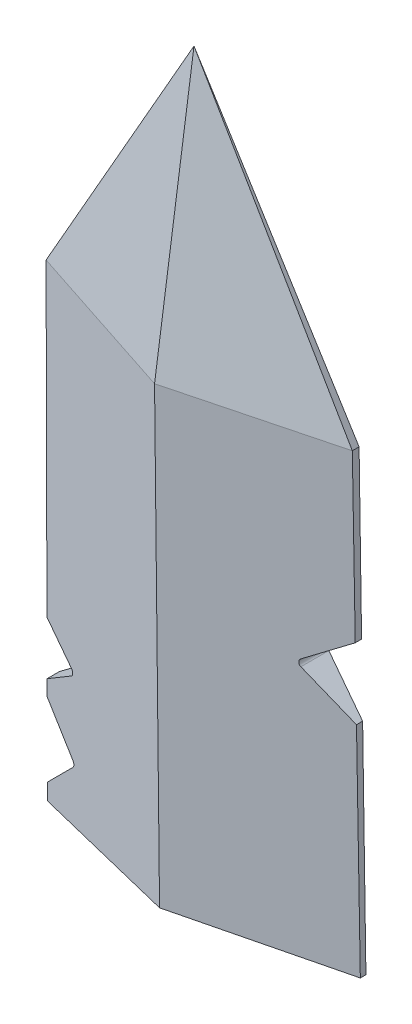
from build123d import *

# Parameters (mm, degrees)
BOSS_EXTRUDE1_DEPTH      = 9.525
BOSS_EXTRUDE1_DEPTH_BACK = 9.525
CUT_SWEEP2_START         = 153.457157687
CUT_SWEEP2_OUTLINE_W     = 59
CUT_SWEEP2_OUTLINE_H     = 64
CUT_SWEEP2_DEPTH         = 10.542842313
CUT_SWEEP6_START         = 153.457157687
CUT_SWEEP6_OUTLINE_W     = 53
CUT_SWEEP6_OUTLINE_H     = 64
CUT_SWEEP6_DEPTH         = 9.143384714
SKETCH21_W               = 71.62814367
SKETCH21_H               = 75.485551221
CUT_EXTRUDE5_DEPTH       = 47.371
CUT_EXTRUDE6_DEPTH       = 875.211365037
CUT_EXTRUDE6_DEPTH_BACK  = 875.211365037
SKETCH23_R               = 3.175
CUT_EXTRUDE7_DEPTH       = 558.8
CUT_EXTRUDE17_DEPTH      = 875.211365037
CUT_EXTRUDE17_DEPTH_BACK = 875.211365037
SKETCH24_W               = 149.671164142
SKETCH24_H               = 168.486967634
SKETCH24_H_2             = 161.925
SKETCH31_R               = 1.5875
CUT_EXTRUDE18_DEPTH      = 12.7


with BuildPart() as part:
    # Sketch1 → Boss-Extrude1 (new, two sides: drawn at the far end of the back side and taken through both)
    with BuildSketch(Plane.XY.offset(-BOSS_EXTRUDE1_DEPTH_BACK)):
        Polygon((57.217766507, 219.836565958), (134.681996719, 219.836565958), (125.140068317, 803.55209701), (88.830980485, 863.721914098), (57.217766507, 807.103985498), align=None)
    extrude(amount=BOSS_EXTRUDE1_DEPTH + BOSS_EXTRUDE1_DEPTH_BACK)

    # Cut-Sweep1: sweep along a path in Sketch4
    with BuildLine(Plane.XY.offset(9.525)) as cut_sweep1_path:
        Line((95.949881613, 219.836565958), (88.830980485, 863.721914098))
    # Sketch2 → Cut-Sweep1 (sweep, cut)
    with BuildSketch(Plane.XZ.offset(-219.836565958)):
        Polygon((95.949881613, 9.525), (134.681996719, 0), (134.681996719, 9.525), align=None)
    sweep(path=cut_sweep1_path.line, mode=Mode.SUBTRACT)

    # Cut-Sweep2: read off the stored shape, not the designer's step
    # Cut-Sweep2 outline → Cut-Sweep2 (cut)
    with BuildSketch(Plane(origin=(0, 0, 0), x_dir=(0.9721406430200956, -0.0370263288920756, -0.23145544097568965), z_dir=(0.2343983152423991, 0.15356253367517805, 0.9599354030677193)).offset(CUT_SWEEP2_START)):
        with Locations((63.5, 822)):
            Rectangle(CUT_SWEEP2_OUTLINE_W, CUT_SWEEP2_OUTLINE_H)
    extrude(amount=CUT_SWEEP2_DEPTH, mode=Mode.SUBTRACT)

    # Cut-Sweep3: sweep along a path in Sketch8
    with BuildLine(Plane.XY.offset(9.525)) as cut_sweep3_path:
        Line((95.949881613, 219.836565958), (88.830980485, 863.721914098))
    # Sketch7 → Cut-Sweep3 (sweep, cut)
    with BuildSketch(Plane.XZ.offset(-219.836565958)):
        Polygon((95.949881613, 9.525), (57.217766507, 0), (57.217766507, 9.525), align=None)
    sweep(path=cut_sweep3_path.line, mode=Mode.SUBTRACT)

    # Cut-Sweep4: sweep along a path in Sketch10
    with BuildLine(Plane(origin=(3.4015871, 0.0376085, -13.832090615), x_dir=(0.9710677735095292, -0.0006492893666849942, 0.23880317768941897), z_dir=(-0.23880406037428656, -0.002640256529482778, 0.9710641841784778))) as cut_sweep4_path:
        Line((55.419591582, 807.105343631), (88.664251397, 803.18099011))
    # Sketch9 → Cut-Sweep4 (sweep, cut)
    with BuildSketch(Plane(origin=(98.36840601, 1.087577095, 0), x_dir=(0, 0, 1), z_dir=(-0.9999388862366849, -0.011055486951654862, 0))):
        Polygon((9.525, 802.119504525), (27.927952665, 862.687059056), (0, 862.687059056), align=None)
    sweep(path=cut_sweep4_path.line, mode=Mode.SUBTRACT)

    # Cut-Sweep5: sweep along a path in Sketch12
    with BuildLine(Plane(origin=(0, 0, -9.525), x_dir=(-1, 0, 0), z_dir=(0, 0, -1))) as cut_sweep5_path:
        Line((-88.830980485, 863.721914098), (-95.949881613, 219.836565958))
    # Sketch11 → Cut-Sweep5 (sweep, cut)
    with BuildSketch(Plane.XZ.offset(-219.836565958)):
        Polygon((95.949881613, -9.525), (134.681996719, 0), (134.681996719, -15.883536915), (57.217766507, -15.883536915), (57.217766507, 0), align=None)
    sweep(path=cut_sweep5_path.line, mode=Mode.SUBTRACT)

    # Cut-Sweep6: read off the stored shape, not the designer's step
    # Cut-Sweep6 outline → Cut-Sweep6 (cut)
    with BuildSketch(Plane(origin=(0, 0, 0), x_dir=(0.9721406430200958, -0.03702632889207545, 0.2314554409756887), z_dir=(0.23439831524239813, 0.1535625336751781, -0.9599354030677195)).offset(CUT_SWEEP6_START)):
        with Locations((66.5, -822)):
            Rectangle(CUT_SWEEP6_OUTLINE_W, CUT_SWEEP6_OUTLINE_H)
    extrude(amount=CUT_SWEEP6_DEPTH, mode=Mode.SUBTRACT)

    # Sketch21 → Cut-Extrude5 (cut)
    with BuildSketch(Plane(origin=(-23.933102236, 16.341018935, -105.585382191), x_dir=(-0.9758175121644082, -0.033431767496308724, 0.2160150454837301), z_dir=(-0.2185867858615091, 0.14924646088248067, -0.9643367207364807))):
        with Locations((-95.99768501, 822.261491576)):
            Rectangle(SKETCH21_W, SKETCH21_H)
    extrude(amount=CUT_EXTRUDE5_DEPTH, mode=Mode.SUBTRACT)

    # Sketch22 → Cut-Extrude6 (cut, two sides: drawn at the far end of the back side and taken through both)
    with BuildSketch(Plane.XY.offset(-CUT_EXTRUDE6_DEPTH_BACK)):
        with BuildLine():
            Line((57.217766507, 737.561994928), (64.475710809, 732.15618288))
            ThreePointArc((64.475710809, 732.15618288), (64.859122479, 731.376710767), (64.450428737, 730.610192203))
            Line((64.450428737, 730.610192203), (57.217766507, 725.582342683))
            Line((57.217766507, 725.582342683), (57.217766507, 737.561994928))
        make_face()
        with BuildLine():
            Line((57.217766507, 722.071065301), (64.863611969, 714.425219839))
            ThreePointArc((64.863611969, 714.425219839), (65.14259276, 713.751700629), (64.863611969, 713.07818142))
            Line((64.863611969, 713.07818142), (57.217766507, 705.432335958))
            Line((57.217766507, 705.432335958), (57.217766507, 722.071065301))
        make_face()
        with BuildLine():
            Line((125.746024678, 766.483474766), (115.991696873, 759.702666979))
            ThreePointArc((115.991696873, 759.702666979), (115.583003131, 758.936148415), (115.966414801, 758.156676302))
            Line((115.966414801, 758.156676302), (126.004357543, 750.680284978))
            Line((126.004357543, 750.680284978), (125.746024678, 766.483474766))
        make_face()
        with BuildLine():
            Line((130.504368952, 475.397717553), (120.864153688, 462.45458434))
            ThreePointArc((120.864153688, 462.45458434), (120.675678689, 461.901197798), (120.845958337, 461.341944429))
            Line((120.845958337, 461.341944429), (130.972260191, 446.775056406))
            Line((130.972260191, 446.775056406), (130.504368952, 475.397717553))
        make_face()
        with BuildLine():
            Line((57.217766507, 423.998589411), (65.145848829, 412.59388421))
            ThreePointArc((65.145848829, 412.59388421), (65.316128476, 412.03463084), (65.127653478, 411.481244299))
            Line((65.127653478, 411.481244299), (57.217766507, 400.861282196))
            Line((57.217766507, 400.861282196), (57.217766507, 423.998589411))
        make_face()
    extrude(amount=CUT_EXTRUDE6_DEPTH + CUT_EXTRUDE6_DEPTH_BACK, mode=Mode.SUBTRACT)

    # Sketch23 → Cut-Extrude7 (cut)
    with BuildSketch(Plane.XZ.offset(-219.836565958)):
        with Locations(Location((95.949881613, 0, 0), (0, 0, 270))):
            Circle(SKETCH23_R)
    extrude(amount=-CUT_EXTRUDE7_DEPTH, mode=Mode.SUBTRACT)

    # Sketch24 → Cut-Extrude17 (cut, two sides: drawn at the far end of the back side and taken through both)
    with BuildSketch(Plane.XY.offset(-CUT_EXTRUDE17_DEPTH_BACK)):
        with Locations((94.66698592, 293.703430281)):
            Rectangle(SKETCH24_W, SKETCH24_H)
        with Locations((94.66698592, 458.909414098)):
            Rectangle(SKETCH24_W, SKETCH24_H_2)
        with Locations((94.66698592, 620.834414098)):
            Rectangle(SKETCH24_W, SKETCH24_H_2)
    extrude(amount=CUT_EXTRUDE17_DEPTH + CUT_EXTRUDE17_DEPTH_BACK, mode=Mode.SUBTRACT)

    # Sketch31 → Cut-Extrude18 (cut)
    with BuildSketch(Plane.XZ.offset(-701.796914098)):
        with Locations(Location((83.249881613, 0, 0), (0, 0, 270))):
            Circle(SKETCH31_R)
        with Locations(Location((108.649881613, 0, 0), (0, 0, 270))):
            Circle(SKETCH31_R)
    extrude(amount=-CUT_EXTRUDE18_DEPTH, mode=Mode.SUBTRACT)


solid = part.part
